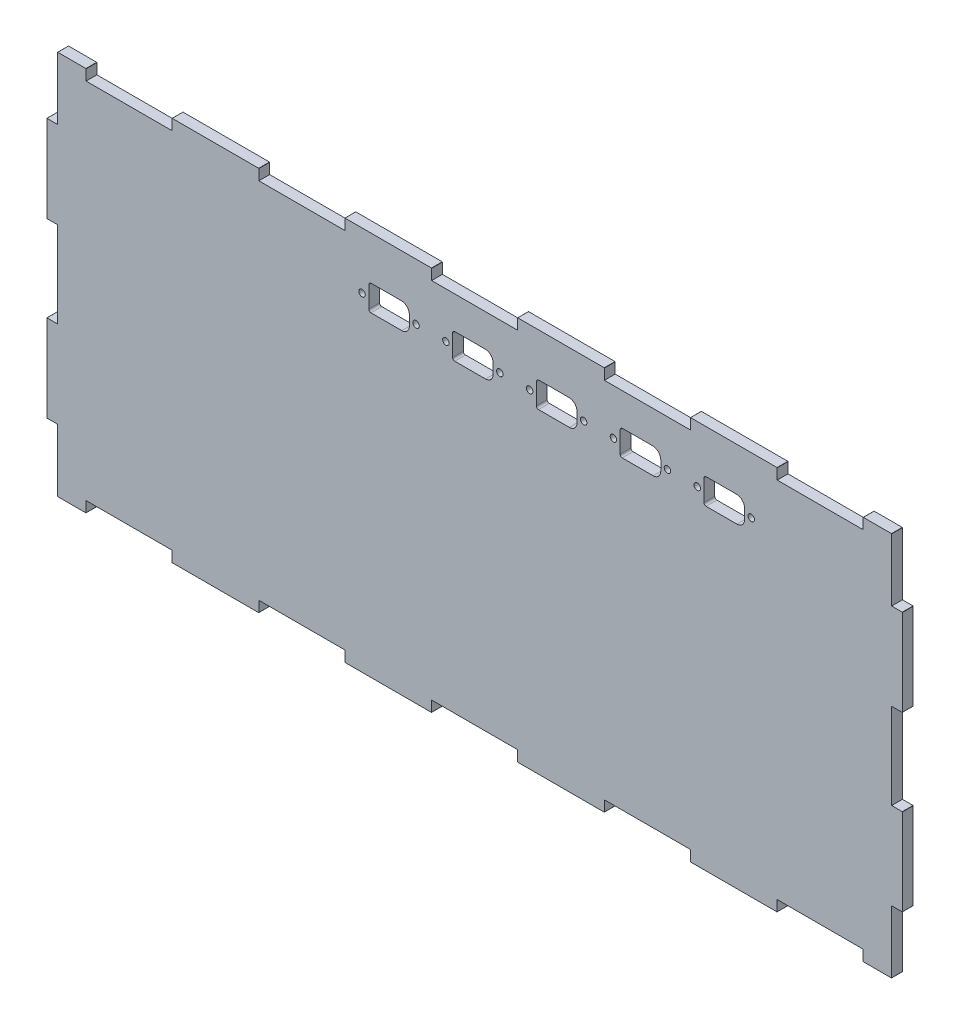
from build123d import *

# Parameters (mm, degrees)
BOSS_EXTRUDE1_DEPTH = 5
SKETCH2_R           = 1.5
CUT_EXTRUDE1_DEPTH  = 218.272685812


with BuildPart() as part:
    # Model → Boss-Extrude1 (new body)
    with BuildSketch(Plane.XY):
        Polygon((-179.94, -89.08), (-179.93, -89.07), (-179.92, -89.05), (-179.91, -89.04), (-179.9, -89.02), (-179.9, -84.1), (-140.1, -84.1), (-140.1, -89.02), (-140.08, -89.06), (-140.07, -89.07), (-140.05, -89.08), (-140.04, -89.09), (-140.02, -89.1), (-99.98, -89.1), (-99.94, -89.08), (-99.93, -89.07), (-99.92, -89.05), (-99.91, -89.04), (-99.9, -89.02), (-99.9, -84.1), (-60.1, -84.1), (-60.1, -89.02), (-60.08, -89.06), (-60.07, -89.07), (-60.05, -89.08), (-60.04, -89.09), (-60.02, -89.1), (-19.98, -89.1), (-19.94, -89.08), (-19.93, -89.07), (-19.92, -89.05), (-19.91, -89.04), (-19.9, -89.02), (-19.9, -84.1), (19.9, -84.1), (19.9, -89.02), (19.92, -89.06), (19.93, -89.07), (19.95, -89.08), (19.96, -89.09), (19.98, -89.1), (60.02, -89.1), (60.06, -89.08), (60.07, -89.07), (60.08, -89.05), (60.09, -89.04), (60.1, -89.02), (60.1, -84.1), (99.9, -84.1), (99.9, -89.02), (99.92, -89.06), (99.93, -89.07), (99.95, -89.08), (99.96, -89.09), (99.98, -89.1), (140.02, -89.1), (140.06, -89.08), (140.07, -89.07), (140.08, -89.05), (140.09, -89.04), (140.1, -89.02), (140.1, -84.1), (179.9, -84.1), (179.9, -89.02), (179.92, -89.06), (179.93, -89.07), (179.95, -89.08), (179.96, -89.09), (179.98, -89.1), (193.02, -89.1), (193.06, -89.08), (193.07, -89.07), (193.08, -89.05), (193.09, -89.04), (193.1, -89.02), (193.1, -60.1), (198.02, -60.1), (198.06, -60.08), (198.07, -60.07), (198.08, -60.05), (198.09, -60.04), (198.1, -60.02), (198.1, -19.98), (198.08, -19.94), (198.07, -19.93), (198.05, -19.92), (198.04, -19.91), (198.02, -19.9), (193.1, -19.9), (193.1, 19.9), (198.02, 19.9), (198.06, 19.92), (198.07, 19.93), (198.08, 19.95), (198.09, 19.96), (198.1, 19.98), (198.1, 60.02), (198.08, 60.06), (198.07, 60.07), (198.05, 60.08), (198.04, 60.09), (198.02, 60.1), (193.1, 60.1), (193.1, 89.02), (193.08, 89.06), (193.07, 89.07), (193.05, 89.08), (193.04, 89.09), (193.02, 89.1), (179.98, 89.1), (179.94, 89.08), (179.93, 89.07), (179.92, 89.05), (179.91, 89.04), (179.9, 89.02), (179.9, 84.1), (140.1, 84.1), (140.1, 89.02), (140.08, 89.06), (140.07, 89.07), (140.05, 89.08), (140.04, 89.09), (140.02, 89.1), (99.98, 89.1), (99.94, 89.08), (99.93, 89.07), (99.92, 89.05), (99.91, 89.04), (99.9, 89.02), (99.9, 84.1), (60.1, 84.1), (60.1, 89.02), (60.08, 89.06), (60.07, 89.07), (60.05, 89.08), (60.04, 89.09), (60.02, 89.1), (19.98, 89.1), (19.94, 89.08), (19.93, 89.07), (19.92, 89.05), (19.91, 89.04), (19.9, 89.02), (19.9, 84.1), (-19.9, 84.1), (-19.9, 89.02), (-19.92, 89.06), (-19.93, 89.07), (-19.95, 89.08), (-19.96, 89.09), (-19.98, 89.1), (-60.02, 89.1), (-60.06, 89.08), (-60.07, 89.07), (-60.08, 89.05), (-60.09, 89.04), (-60.1, 89.02), (-60.1, 84.1), (-99.9, 84.1), (-99.9, 89.02), (-99.92, 89.06), (-99.93, 89.07), (-99.95, 89.08), (-99.96, 89.09), (-99.98, 89.1), (-140.02, 89.1), (-140.06, 89.08), (-140.07, 89.07), (-140.08, 89.05), (-140.09, 89.04), (-140.1, 89.02), (-140.1, 84.1), (-179.9, 84.1), (-179.9, 89.02), (-179.92, 89.06), (-179.93, 89.07), (-179.95, 89.08), (-179.96, 89.09), (-179.98, 89.1), (-193.02, 89.1), (-193.06, 89.08), (-193.07, 89.07), (-193.08, 89.05), (-193.09, 89.04), (-193.1, 89.02), (-193.1, 60.1), (-198.02, 60.1), (-198.06, 60.08), (-198.07, 60.07), (-198.08, 60.05), (-198.09, 60.04), (-198.1, 60.02), (-198.1, 19.98), (-198.08, 19.94), (-198.07, 19.93), (-198.05, 19.92), (-198.04, 19.91), (-198.02, 19.9), (-193.1, 19.9), (-193.1, -19.9), (-198.02, -19.9), (-198.06, -19.92), (-198.07, -19.93), (-198.08, -19.95), (-198.09, -19.96), (-198.1, -19.98), (-198.1, -60.02), (-198.08, -60.06), (-198.07, -60.07), (-198.05, -60.08), (-198.04, -60.09), (-198.02, -60.1), (-193.1, -60.1), (-193.1, -89.02), (-193.08, -89.06), (-193.07, -89.07), (-193.05, -89.08), (-193.04, -89.09), (-193.02, -89.1), (-179.98, -89.1), align=None)
    extrude(amount=BOSS_EXTRUDE1_DEPTH)

    # Sketch2 → Cut-Extrude1 (cut, through all)
    with BuildSketch(Plane.XY.offset(5)):
        with Locations((-52.108840949, 62.97)):
            Circle(SKETCH2_R)
        with Locations((-27.108840949, 62.97)):
            Circle(SKETCH2_R)
        with Locations((-13.308840949, 62.97)):
            Circle(SKETCH2_R)
        with Locations((11.691159051, 62.97)):
            Circle(SKETCH2_R)
        with Locations((25.491159051, 62.97)):
            Circle(SKETCH2_R)
        with Locations((50.491159051, 62.97)):
            Circle(SKETCH2_R)
        with Locations((64.291159051, 62.97)):
            Circle(SKETCH2_R)
        with Locations((89.291159051, 62.97)):
            Circle(SKETCH2_R)
        with Locations((103.091159051, 62.97)):
            Circle(SKETCH2_R)
        with Locations((128.091159051, 62.97)):
            Circle(SKETCH2_R)
        with BuildLine():
            Line((-33.733840949, 57.12), (-48.008840949, 57.12))
            ThreePointArc((-48.008840949, 57.12), (-48.71594773, 57.412893219), (-49.008840949, 58.12))
            Line((-49.008840949, 58.12), (-49.008840949, 67.82))
            ThreePointArc((-49.008840949, 67.82), (-48.657369086, 68.668528137), (-47.808840949, 69.02))
            Line((-47.808840949, 69.02), (-33.933840949, 69.02))
            ThreePointArc((-33.933840949, 69.02), (-31.299868189, 67.92897276), (-30.208840949, 65.295))
            Line((-30.208840949, 65.295), (-30.208840949, 60.645))
            ThreePointArc((-30.208840949, 60.645), (-31.241289545, 58.152448596), (-33.733840949, 57.12))
        make_face()
        with BuildLine():
            Line((5.066159051, 57.12), (-9.208840949, 57.12))
            ThreePointArc((-9.208840949, 57.12), (-9.91594773, 57.412893219), (-10.208840949, 58.12))
            Line((-10.208840949, 58.12), (-10.208840949, 67.82))
            ThreePointArc((-10.208840949, 67.82), (-9.857369086, 68.668528137), (-9.008840949, 69.02))
            Line((-9.008840949, 69.02), (4.866159051, 69.02))
            ThreePointArc((4.866159051, 69.02), (7.500131811, 67.92897276), (8.591159051, 65.295))
            Line((8.591159051, 65.295), (8.591159051, 60.645))
            ThreePointArc((8.591159051, 60.645), (7.558710455, 58.152448596), (5.066159051, 57.12))
        make_face()
        with BuildLine():
            Line((43.866159051, 57.12), (29.591159051, 57.12))
            ThreePointArc((29.591159051, 57.12), (28.88405227, 57.412893219), (28.591159051, 58.12))
            Line((28.591159051, 58.12), (28.591159051, 67.82))
            ThreePointArc((28.591159051, 67.82), (28.942630914, 68.668528137), (29.791159051, 69.02))
            Line((29.791159051, 69.02), (43.666159051, 69.02))
            ThreePointArc((43.666159051, 69.02), (46.300131811, 67.92897276), (47.391159051, 65.295))
            Line((47.391159051, 65.295), (47.391159051, 60.645))
            ThreePointArc((47.391159051, 60.645), (46.358710455, 58.152448596), (43.866159051, 57.12))
        make_face()
        with BuildLine():
            Line((82.666159051, 57.12), (68.391159051, 57.12))
            ThreePointArc((68.391159051, 57.12), (67.68405227, 57.412893219), (67.391159051, 58.12))
            Line((67.391159051, 58.12), (67.391159051, 67.82))
            ThreePointArc((67.391159051, 67.82), (67.742630914, 68.668528137), (68.591159051, 69.02))
            Line((68.591159051, 69.02), (82.466159051, 69.02))
            ThreePointArc((82.466159051, 69.02), (85.100131811, 67.92897276), (86.191159051, 65.295))
            Line((86.191159051, 65.295), (86.191159051, 60.645))
            ThreePointArc((86.191159051, 60.645), (85.158710455, 58.152448596), (82.666159051, 57.12))
        make_face()
        with BuildLine():
            Line((121.466159051, 57.12), (107.191159051, 57.12))
            ThreePointArc((107.191159051, 57.12), (106.48405227, 57.412893219), (106.191159051, 58.12))
            Line((106.191159051, 58.12), (106.191159051, 67.82))
            ThreePointArc((106.191159051, 67.82), (106.542630914, 68.668528137), (107.391159051, 69.02))
            Line((107.391159051, 69.02), (121.266159051, 69.02))
            ThreePointArc((121.266159051, 69.02), (123.900131811, 67.92897276), (124.991159051, 65.295))
            Line((124.991159051, 65.295), (124.991159051, 60.645))
            ThreePointArc((124.991159051, 60.645), (123.958710455, 58.152448596), (121.466159051, 57.12))
        make_face()
    extrude(amount=-CUT_EXTRUDE1_DEPTH, mode=Mode.SUBTRACT)


solid = part.part
